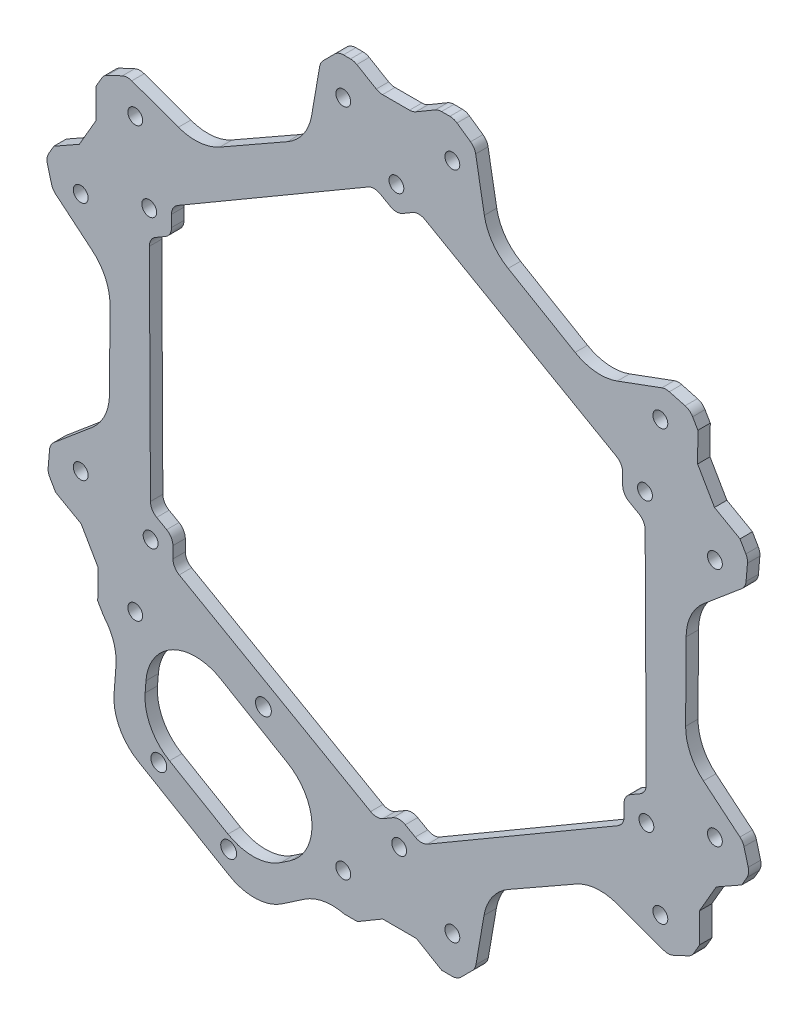
from build123d import *
from OCP.BRepFilletAPI import BRepFilletAPI_MakeChamfer

# Parameters (mm, degrees)
BOSS_EXTRUDE1_DEPTH = 2.5
FILLET2_R           = 10
CHAMFER1_SIZE       = 3
CHAMFER1_SIZE2      = 3.705314064
CHAMFER1_SIZE2_2    = 3.678458211
CUT_EXTRUDE2_DEPTH  = 2.5
CIRPATTERN1_COUNT   = 6
CUT_EXTRUDE4_DEPTH  = 9.5
SKETCH8_R           = 1.5
CUT_EXTRUDE7_DEPTH  = 9.5
FILLET6_R           = 2.5
CIRPATTERN3_COUNT   = 6
BOSS_EXTRUDE2_DEPTH = 2.5
FILLET7_R           = 10
CUT_EXTRUDE8_DEPTH  = 2.5


with BuildPart() as part:
    # Sketch1 → Boss-Extrude1 (new body)
    with BuildSketch(Plane.XY):
        Polygon((15, 75), (-15, 75), (-18.188921512, 56.50369281), (-39.913618866, 44.132859174), (-57.451905284, 50.490381057), (-72.451905284, 24.509618943), (-58.028094137, 12.499778308), (-58.176986619, -12.499778308), (-72.451905284, -24.509618943), (-57.451905284, -50.490381057), (-39.839172625, -44.003914502), (-18.263367753, -56.632637482), (-15, -75), (15, -75), (18.188921512, -56.50369281), (39.913618866, -44.132859174), (57.451905284, -50.490381057), (72.451905284, -24.509618943), (58.028094137, -12.499778308), (58.176986619, 12.499778308), (72.451905284, 24.509618943), (57.451905284, 50.490381057), (39.839172625, 44.003914502), (18.263367753, 56.632637482), align=None)
    extrude(amount=BOSS_EXTRUDE1_DEPTH)

    # Fillet2
    fillet2_edges = [part.edges().sort_by_distance(p)[0] for p in [
        (18.263367753, 56.632637482, 1.25),
        (39.839172625, 44.003914502, 1.25),
        (58.176986619, 12.499778308, 1.25),
        (58.028094137, -12.499778308, 1.25),
        (39.913618866, -44.132859174, 1.25),
        (18.188921512, -56.50369281, 1.25),
        (-18.263367753, -56.632637482, 1.25),
        (-39.839172625, -44.003914502, 1.25),
        (-58.176986619, -12.499778308, 1.25),
        (-58.028094137, 12.499778308, 1.25),
        (-39.913618866, 44.132859174, 1.25),
        (-18.188921512, 56.50369281, 1.25),
    ]]
    fillet(fillet2_edges, radius=FILLET2_R)

    # Chamfer1: one chamfer whose edges measure the first distance from different faces: ONE call of the kernel's chamfer builder (chamfer() names one face for all edges)
    chamfer1_edges_1 = [part.edges().sort_by_distance(p)[0] for p in [
        (15, 75, 1.25),
    ]]
    chamfer1_side_1 = [part.faces().sort_by_distance(p)[0] for p in [
        (16.227681019, 68.090186566, 1.25),
    ]]
    chamfer1_edges_2 = [part.edges().sort_by_distance(p)[0] for p in [
        (57.451905284, 50.490381057, 1.25),
    ]]
    chamfer1_side_2 = [part.faces().sort_by_distance(p)[0] for p in [
        (64.951905284, 37.5, 1.25),
    ]]
    chamfer1_edges_3 = [part.edges().sort_by_distance(p)[0] for p in [
        (72.451905284, 24.509618943, 1.25),
    ]]
    chamfer1_side_3 = [part.faces().sort_by_distance(p)[0] for p in [
        (67.081671824, 19.991509275, 1.25),
    ]]
    chamfer1_edges_4 = [part.edges().sort_by_distance(p)[0] for p in [
        (72.451905284, -24.509618943, 1.25),
    ]]
    chamfer1_side_4 = [part.faces().sort_by_distance(p)[0] for p in [
        (64.951905284, -37.5, 1.25),
    ]]
    chamfer1_edges_5 = [part.edges().sort_by_distance(p)[0] for p in [
        (57.451905284, -50.490381057, 1.25),
    ]]
    chamfer1_side_5 = [part.faces().sort_by_distance(p)[0] for p in [
        (50.853990805, -48.09867729, 1.25),
    ]]
    chamfer1_edges_6 = [part.edges().sort_by_distance(p)[0] for p in [
        (15, -75, 1.25),
    ]]
    chamfer1_side_6 = [part.faces().sort_by_distance(p)[0] for p in [
        (0, -75, 1.25),
    ]]
    chamfer1_edges_7 = [part.edges().sort_by_distance(p)[0] for p in [
        (-15, -75, 1.25),
    ]]
    chamfer1_side_7 = [part.faces().sort_by_distance(p)[0] for p in [
        (-16.227681019, -68.090186566, 1.25),
    ]]
    chamfer1_edges_8 = [part.edges().sort_by_distance(p)[0] for p in [
        (-57.451905284, -50.490381057, 1.25),
    ]]
    chamfer1_side_8 = [part.faces().sort_by_distance(p)[0] for p in [
        (-64.951905284, -37.5, 1.25),
    ]]
    chamfer1_edges_9 = [part.edges().sort_by_distance(p)[0] for p in [
        (-72.451905284, -24.509618943, 1.25),
    ]]
    chamfer1_side_9 = [part.faces().sort_by_distance(p)[0] for p in [
        (-67.081671824, -19.991509275, 1.25),
    ]]
    chamfer1_edges_10 = [part.edges().sort_by_distance(p)[0] for p in [
        (-72.451905284, 24.509618943, 1.25),
    ]]
    chamfer1_side_10 = [part.faces().sort_by_distance(p)[0] for p in [
        (-64.951905284, 37.5, 1.25),
    ]]
    chamfer1_edges_11 = [part.edges().sort_by_distance(p)[0] for p in [
        (-57.451905284, 50.490381057, 1.25),
    ]]
    chamfer1_side_11 = [part.faces().sort_by_distance(p)[0] for p in [
        (-50.853990805, 48.09867729, 1.25),
    ]]
    chamfer1_edges_12 = [part.edges().sort_by_distance(p)[0] for p in [
        (-15, 75, 1.25),
    ]]
    chamfer1_side_12 = [part.faces().sort_by_distance(p)[0] for p in [
        (0, 75, 1.25),
    ]]
    chamfer1 = BRepFilletAPI_MakeChamfer(part.part.solid().wrapped)
    for e in chamfer1_edges_1:
        chamfer1.Add(CHAMFER1_SIZE, CHAMFER1_SIZE2, e.wrapped, chamfer1_side_1[0].wrapped)  # the first distance lies on this face
    for e in chamfer1_edges_2:
        chamfer1.Add(CHAMFER1_SIZE, CHAMFER1_SIZE2_2, e.wrapped, chamfer1_side_2[0].wrapped)  # the first distance lies on this face
    for e in chamfer1_edges_3:
        chamfer1.Add(CHAMFER1_SIZE, CHAMFER1_SIZE2, e.wrapped, chamfer1_side_3[0].wrapped)  # the first distance lies on this face
    for e in chamfer1_edges_4:
        chamfer1.Add(CHAMFER1_SIZE, CHAMFER1_SIZE2_2, e.wrapped, chamfer1_side_4[0].wrapped)  # the first distance lies on this face
    for e in chamfer1_edges_5:
        chamfer1.Add(CHAMFER1_SIZE, CHAMFER1_SIZE2, e.wrapped, chamfer1_side_5[0].wrapped)  # the first distance lies on this face
    for e in chamfer1_edges_6:
        chamfer1.Add(CHAMFER1_SIZE, CHAMFER1_SIZE2_2, e.wrapped, chamfer1_side_6[0].wrapped)  # the first distance lies on this face
    for e in chamfer1_edges_7:
        chamfer1.Add(CHAMFER1_SIZE, CHAMFER1_SIZE2, e.wrapped, chamfer1_side_7[0].wrapped)  # the first distance lies on this face
    for e in chamfer1_edges_8:
        chamfer1.Add(CHAMFER1_SIZE, CHAMFER1_SIZE2_2, e.wrapped, chamfer1_side_8[0].wrapped)  # the first distance lies on this face
    for e in chamfer1_edges_9:
        chamfer1.Add(CHAMFER1_SIZE, CHAMFER1_SIZE2, e.wrapped, chamfer1_side_9[0].wrapped)  # the first distance lies on this face
    for e in chamfer1_edges_10:
        chamfer1.Add(CHAMFER1_SIZE, CHAMFER1_SIZE2_2, e.wrapped, chamfer1_side_10[0].wrapped)  # the first distance lies on this face
    for e in chamfer1_edges_11:
        chamfer1.Add(CHAMFER1_SIZE, CHAMFER1_SIZE2, e.wrapped, chamfer1_side_11[0].wrapped)  # the first distance lies on this face
    for e in chamfer1_edges_12:
        chamfer1.Add(CHAMFER1_SIZE, CHAMFER1_SIZE2_2, e.wrapped, chamfer1_side_12[0].wrapped)  # the first distance lies on this face
    add(Compound.cast(chamfer1.Shape()), mode=Mode.REPLACE)

    # Sketch2 → Cut-Extrude2 (cut)
    with BuildSketch(Plane.XY):
        with BuildLine():
            ThreePointArc((12.5, 67.5), (11, 69), (9.5, 67.5))
            Line((9.5, 67.5), (12.5, 67.5))
        make_face()
        with BuildLine():
            Line((12.5, 67.5), (9.5, 67.5))
            ThreePointArc((9.5, 67.5), (11, 66), (12.5, 67.5))
        make_face()
        with BuildLine():
            ThreePointArc((-9.5, 67.5), (-11, 69), (-12.5, 67.5))
            Line((-12.5, 67.5), (-11, 67.5))
            Line((-11, 67.5), (-9.5, 67.5))
        make_face()
        with BuildLine():
            Line((-11, 67.5), (-12.5, 67.5))
            ThreePointArc((-12.5, 67.5), (-11, 66), (-9.5, 67.5))
            Line((-9.5, 67.5), (-11, 67.5))
        make_face()
    cut_extrude2 = extrude(amount=CUT_EXTRUDE2_DEPTH, mode=Mode.SUBTRACT)

    # CirPattern1: Cut-Extrude2 ×6 about axis
    cirpattern1_axis = Axis((0, 0, 0), (0, 0, 1))
    for i in range(1, CIRPATTERN1_COUNT):
        add(cut_extrude2.rotate(cirpattern1_axis, i * 360 / CIRPATTERN1_COUNT), mode=Mode.SUBTRACT)

    # Sketch5 → Cut-Extrude4 (cut)
    with BuildSketch(Plane(origin=(0, 0, 0), x_dir=(-1, 0, 0), z_dir=(0, 0, -1))):
        Polygon((8.852657032, 75), (-8.147342968, 75), (-3.047342968, 72), (3.752657032, 72), align=None)
    cut_extrude4 = extrude(amount=-CUT_EXTRUDE4_DEPTH, mode=Mode.SUBTRACT)

    # Sketch8 → Cut-Extrude7 (cut)
    with BuildSketch(Plane(origin=(0, 0, 0), x_dir=(-1, 0, 0), z_dir=(0, 0, -1))):
        with Locations((0.282783597, 57.734334384)):
            Circle(SKETCH8_R)
        Polygon((45.653571285, 31.24235526), (4.770004358, 55.114248537), (0.257333073, 52.538244289), (-4.229887687, 55.158330137), (-45.345337164, 31.688069218), (-45.370787688, 26.491979124), (-49.883458972, 23.915974876), (-50.115341522, -23.426179318), (-45.628120762, -26.046265166), (-45.653571285, -31.24235526), (-4.770004358, -55.114248537), (-0.257333073, -52.538244289), (4.229887687, -55.158330137), (45.345337164, -31.688069218), (45.370787688, -26.491979124), (49.883458972, -23.915974876), (50.115341522, 23.426179318), (45.628120762, 26.046265166), align=None)
        with Locations((50.140792046, 28.622269413)):
            Circle(SKETCH8_R)
        with Locations((-49.858008449, 29.112064971)):
            Circle(SKETCH8_R)
        with Locations((49.858008449, -29.112064971)):
            Circle(SKETCH8_R)
        with Locations((-50.140792046, -28.622269413)):
            Circle(SKETCH8_R)
        with Locations((-0.282783597, -57.734334384)):
            Circle(SKETCH8_R)
    extrude(amount=-CUT_EXTRUDE7_DEPTH, mode=Mode.SUBTRACT)

    # Fillet6
    fillet6_edges = [part.edges().sort_by_distance(p)[0] for p in [
        (54.000094564, 49.219138529, 1.25),
        (70.599248252, 27.718515051, 1.25),
        (58.951905284, 47.892304845, 1.25),
        (70.15628898, 22.57826041, 1.25),
        (69.6250716, -22.155884435, 1.25),
        (59.304562316, -47.281484949, 1.25),
        (70.951905284, -27.107695155, 1.25),
        (54.631491578, -49.467998287, 1.25),
        (15.624977036, -71.375022964, 1.25),
        (-11.294685936, -75, 1.25),
        (12, -75, 1.25),
        (-15.524797401, -72.046258697, 1.25),
        (-54.000094564, -49.219138529, 1.25),
        (-70.599248252, -27.718515051, 1.25),
        (-58.951905284, -47.892304845, 1.25),
        (-70.15628898, -22.57826041, 1.25),
        (-69.6250716, 22.155884435, 1.25),
        (-59.304562316, 47.281484949, 1.25),
        (-70.951905284, 27.107695155, 1.25),
        (-54.631491578, 49.467998287, 1.25),
        (-15.624977036, 71.375022964, 1.25),
        (11.294685936, 75, 1.25),
        (-12, 75, 1.25),
        (15.524797401, 72.046258697, 1.25),
        (3.047342968, 72, 1.25),
        (8.147342968, 75, 1.25),
        (-8.852657032, 75, 1.25),
        (-3.752657032, 72, 1.25),
        (49.883458972, 23.915974876, 1.25),
        (45.370787688, 26.491979124, 1.25),
        (45.345337164, 31.688069218, 1.25),
        (4.229887687, 55.158330137, 1.25),
        (-0.257333073, 52.538244289, 1.25),
        (-4.770004358, 55.114248537, 1.25),
        (-45.653571285, 31.24235526, 1.25),
        (-45.628120762, 26.046265166, 1.25),
        (-50.115341522, 23.426179318, 1.25),
        (-49.883458972, -23.915974876, 1.25),
        (-45.370787688, -26.491979124, 1.25),
        (-45.345337164, -31.688069218, 1.25),
        (-4.229887687, -55.158330137, 1.25),
        (0.257333073, -52.538244289, 1.25),
        (4.770004358, -55.114248537, 1.25),
        (45.653571285, -31.24235526, 1.25),
        (45.628120762, -26.046265166, 1.25),
        (50.115341522, -23.426179318, 1.25),
    ]]
    fillet(fillet6_edges, radius=FILLET6_R)

    # CirPattern3: Cut-Extrude4 ×6 about axis
    cirpattern3_axis = Axis((0, 0, 0), (0, 0, 1))
    for i in range(1, CIRPATTERN3_COUNT):
        add(cut_extrude4.rotate(cirpattern3_axis, i * 360 / CIRPATTERN3_COUNT), mode=Mode.SUBTRACT)

    # Sketch9 → Boss-Extrude2 (add)
    with BuildSketch(Plane.XY.offset(2.5)):
        with BuildLine():
            Line((-28.689780641, -79.497495729), (-41.635263564, -71.920261941))
            Line((-41.635263564, -71.920261941), (-54.580746488, -64.343028153))
            Line((-54.580746488, -64.343028153), (-53.39736908, -48.992395543))
            ThreePointArc((-53.39736908, -48.992395543), (-54.08045931, -49.098652579), (-54.7665337, -49.013771781))
            Line((-54.7665337, -49.013771781), (-56.374699506, -48.582865052))
            Line((-56.374699506, -48.582865052), (-57.716144875, -65.983936686))
            Line((-57.716144875, -65.983936686), (-28.572039914, -83.042527559))
            Line((-28.572039914, -83.042527559), (-13.964720331, -73.135606842))
            Line((-13.964720331, -73.135606842), (-14.675763736, -72.639109695))
            ThreePointArc((-14.675763736, -72.639109695), (-15.351219703, -71.935358971), (-15.705945902, -71.026692274))
            Line((-15.705945902, -71.026692274), (-15.759072081, -70.727679762))
            Line((-15.759072081, -70.727679762), (-28.689780641, -79.497495729))
        make_face()
        with BuildLine():
            Line((-41.635263564, -71.920261941), (-40.119816807, -69.331165356))
            Line((-40.119816807, -69.331165356), (-51.4453481, -62.702119619))
            Line((-51.4453481, -62.702119619), (-50.300925023, -47.856798001))
            Line((-50.300925023, -47.856798001), (-53.255508264, -48.944920199))
            ThreePointArc((-53.255508264, -48.944920199), (-53.326083491, -48.969719186), (-53.39736908, -48.992395543))
            Line((-53.39736908, -48.992395543), (-54.580746488, -64.343028153))
            Line((-54.580746488, -64.343028153), (-41.635263564, -71.920261941))
        make_face()
        Polygon((-28.807521368, -75.952463899), (-40.119816807, -69.331165356), (-41.635263564, -71.920261941), (-28.689780641, -79.497495729), (-15.759072081, -70.727679762), (-16.333852039, -67.492619341), align=None)
    extrude(amount=-BOSS_EXTRUDE2_DEPTH)

    # Fillet7
    # the kernel refuses this fillet: 10 mm, written as the material it adds along each edge
    with BuildSketch(Plane(origin=(-28.807521368, -75.952463899, 2.5), x_dir=(0.8276123485088532, 0.5613000985174155, 0), z_dir=(0, 0, -1))) as fillet7_piece_1:
        with BuildLine():
            CenterArc((FILLET7_R * 0.6307943452, -FILLET7_R), FILLET7_R, 90, 64.486994432)
            Line((-FILLET7_R * 0.271693194189, -FILLET7_R * 0.56928403646), (0, 0))
            Line((0, 0), (FILLET7_R * 0.6307943452, 0))
        make_face()
    extrude(amount=2.5)
    with BuildSketch(Plane(origin=(-51.4453481, -62.702119619, 2.5), x_dir=(0.8630321948954529, -0.5051489192049577, 0), z_dir=(0, 0, -1))) as fillet7_piece_2:
        with BuildLine():
            CenterArc((FILLET7_R * 0.625682193271, -FILLET7_R), FILLET7_R, 90, 64.066963898)
            Line((-FILLET7_R * 0.27362358117, -FILLET7_R * 0.562679609373), (0, 0))
            Line((0, 0), (FILLET7_R * 0.625682193271, 0))
        make_face()
    extrude(amount=2.5)
    with BuildSketch(Plane(origin=(-16.333852039, -67.492619341, 2.5), x_dir=(-0.1749324671409535, 0.9845804344694135, 0), z_dir=(0, 0, -1))) as fillet7_piece_3:
        with BuildLine():
            CenterArc((FILLET7_R * 0.648526709702, -FILLET7_R), FILLET7_R, 90, 65.928972156)
            Line((-FILLET7_R * 0.264513827006, -FILLET7_R * 0.592131175095), (0, 0))
            Line((0, 0), (FILLET7_R * 0.648526709702, 0))
        make_face()
    extrude(amount=2.5)
    with BuildSketch(Plane(origin=(-50.300925023, -47.856798001, 2.5), x_dir=(0.9383851934198175, 0.34559112947304016, 0), z_dir=(0, 0, -1))) as fillet7_piece_4:
        with BuildLine():
            CenterArc((FILLET7_R * 0.641667158144, FILLET7_R), FILLET7_R, 204.626087024, 65.373912976)
            Line((-FILLET7_R * 0.267379322161, FILLET7_R * 0.583305271639), (0, 0))
            Line((0, 0), (FILLET7_R * 0.641667158144, 0))
        make_face()
    extrude(amount=2.5)
    with BuildSketch(Plane(origin=(-13.964720331, -73.135606842, 2.5), x_dir=(0.8502808506401849, -0.5263292458476955, 0), z_dir=(0, 0, -1))) as fillet7_piece_5:
        with BuildLine():
            CenterArc((6.733116105, 9.438783026), FILLET7_R, 204.096473412, 46.616940133)
            Line((-2.39547698, 5.356040285), (-3.308336289, 4.947766011))
            Line((-3.308336289, 4.947766011), (-0.912859308, -0.408274274))
            Line((-0.912859308, -0.408274274), (0.05525517, -0.998472266))
            ThreePointArc((0.05525517, -0.998472266), (2.521565475, -0.861987357), (3.099888376, -0.943878303))
            Line((3.099888376, -0.943878303), (3.430181805, 0))
        make_face()
    extrude(amount=2.5)
    with BuildSketch(Plane(origin=(-56.374699506, -48.582865052, 2.5), x_dir=(-0.9190594801780902, 0.394118855035862, 0), z_dir=(0, 0, -1))) as fillet7_piece_6:
        with BuildLine():
            CenterArc((7.511382083, -8.964827264), FILLET7_R, 116.300478982, 44.896692732)
            Line((-1.954951427, -5.741703022), (-2.901584778, -5.419390597))
            Line((-2.901584778, -5.419390597), (-0.946633351, 0.322312424))
            Line((-0.946633351, 0.322312424), (0.142819484, 0.989748754))
            ThreePointArc((0.142819484, 0.989748754), (1.758669292, 0.756583686), (2.637516545, 0.896482726))
            Line((2.637516545, 0.896482726), (3.080595231, 0))
        make_face()
    extrude(amount=2.5)
    # the kernel refuses this fillet: 10 mm, written as the material it takes off along each edge
    with BuildSketch(Plane(origin=(-28.572039914, -83.042527559, 18.26985863), x_dir=(0.8276123485088529, 0.561300098517416, 0), z_dir=(0, 0, -1))) as fillet7_2_piece_1:
        with BuildLine():
            CenterArc((FILLET7_R * 0.6307943452, -FILLET7_R), FILLET7_R, 90, 64.486994432)
            Line((-FILLET7_R * 0.271693194189, -FILLET7_R * 0.56928403646), (0, 0))
            Line((0, 0), (FILLET7_R * 0.6307943452, 0))
        make_face()
    extrude(amount=34.03971726, mode=Mode.SUBTRACT)
    with BuildSketch(Plane(origin=(-57.716144875, -65.983936686, 18.142054832), x_dir=(0.8630321948954529, -0.5051489192049577, 0), z_dir=(0, 0, -1))) as fillet7_2_piece_2:
        with BuildLine():
            CenterArc((FILLET7_R * 0.625682193271, -FILLET7_R), FILLET7_R, 90, 64.066963898)
            Line((-FILLET7_R * 0.27362358117, -FILLET7_R * 0.562679609373), (0, 0))
            Line((0, 0), (FILLET7_R * 0.625682193271, 0))
        make_face()
    extrude(amount=33.784109664, mode=Mode.SUBTRACT)

    # Sketch10 → Cut-Extrude8 (cut)
    with BuildSketch(Plane.XY.offset(2.5)):
        with BuildLine():
            ThreePointArc((-28.495258346, -46.15523523), (-27.9096177, -48.340875876), (-25.723977054, -47.75523523))
            ThreePointArc((-25.723977054, -47.75523523), (-26.3096177, -45.569594584), (-28.495258346, -46.15523523))
        make_face()
        with BuildLine():
            ThreePointArc((-34.772294104, -76.823548444), (-33.626696722, -76.884068181), (-32.735058022, -76.162239651))
            ThreePointArc((-32.735058022, -76.162239651), (-32.851333322, -74.388221366), (-34.534809135, -73.816758327))
            ThreePointArc((-34.534809135, -73.816758327), (-35.094716953, -74.092874304), (-35.506339314, -74.562239651))
            ThreePointArc((-35.506339314, -74.562239651), (-35.642527199, -75.856241597), (-34.772294104, -76.823548444))
        make_face()
        with BuildLine():
            ThreePointArc((-49.144997461, -68.525464298), (-47.298646245, -68.548860254), (-46.659783368, -66.81640119))
            ThreePointArc((-46.659783368, -66.81640119), (-47.996422784, -65.644199888), (-49.590905335, -66.430511667))
            ThreePointArc((-49.590905335, -66.430511667), (-49.770207824, -67.563607726), (-49.144997461, -68.525464298))
        make_face()
    extrude(amount=-CUT_EXTRUDE8_DEPTH, mode=Mode.SUBTRACT)


solid = part.part
